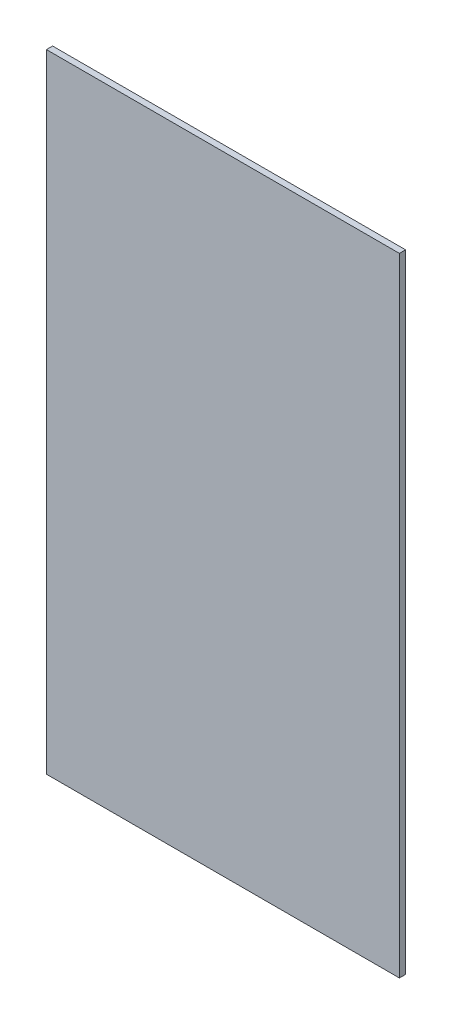
from build123d import *

# Parameters (mm, degrees)
SKETCH1_W           = 57.15
SKETCH1_H           = 101.6
BOSS_EXTRUDE1_DEPTH = 1


with BuildPart() as part:
    # Sketch1 → Boss-Extrude1 (new body)
    with BuildSketch(Plane.XY):
        with Locations((28.575, 50.8)):
            Rectangle(SKETCH1_W, SKETCH1_H)
    extrude(amount=BOSS_EXTRUDE1_DEPTH)


solid = part.part
